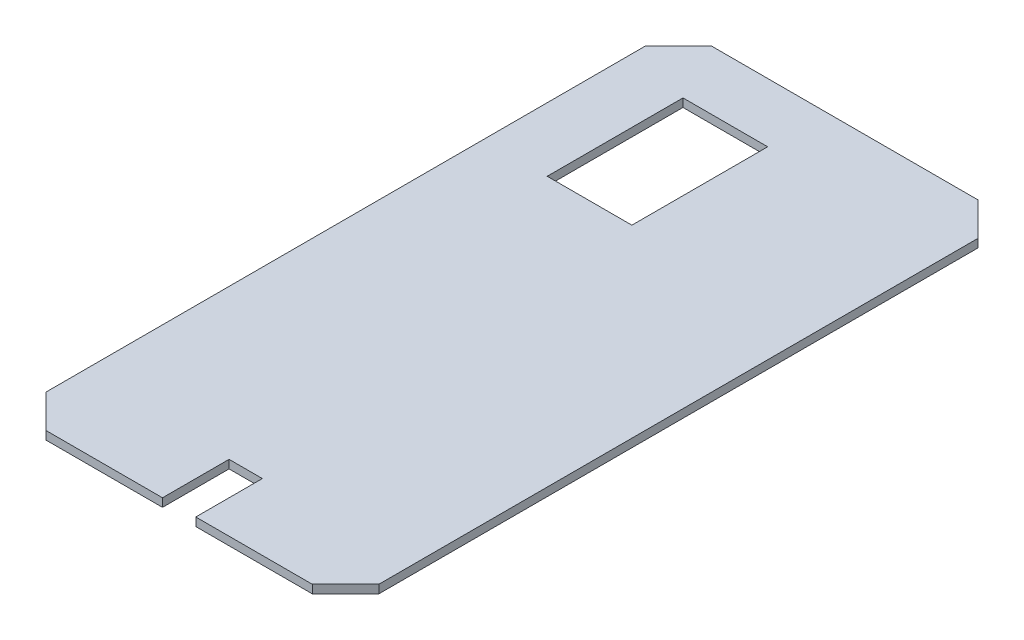
from build123d import *

# Parameters (mm, degrees)
SKETCH2_W           = 32.310298855
SKETCH2_H           = 51.805263963
BOSS_EXTRUDE1_DEPTH = 3.175


with BuildPart() as part:
    # Sketch2 → Boss-Extrude1 (new body)
    with BuildSketch(Plane(origin=(0, 0, 0), x_dir=(1, 0, 0), z_dir=(0, 1, 0))):
        Polygon((0, 241.3), (0, 12.7), (12.7, 0), (57.15, 0), (57.15, 25.4), (69.85, 25.4), (69.85, 0), (114.3, 0), (127, 12.7), (127, 241.3), (114.3, 254), (12.7, 254), align=None)
        with Locations((40.4683413, 205.521044308)):
            Rectangle(SKETCH2_W, SKETCH2_H, mode=Mode.SUBTRACT)
    extrude(amount=BOSS_EXTRUDE1_DEPTH)


solid = part.part
